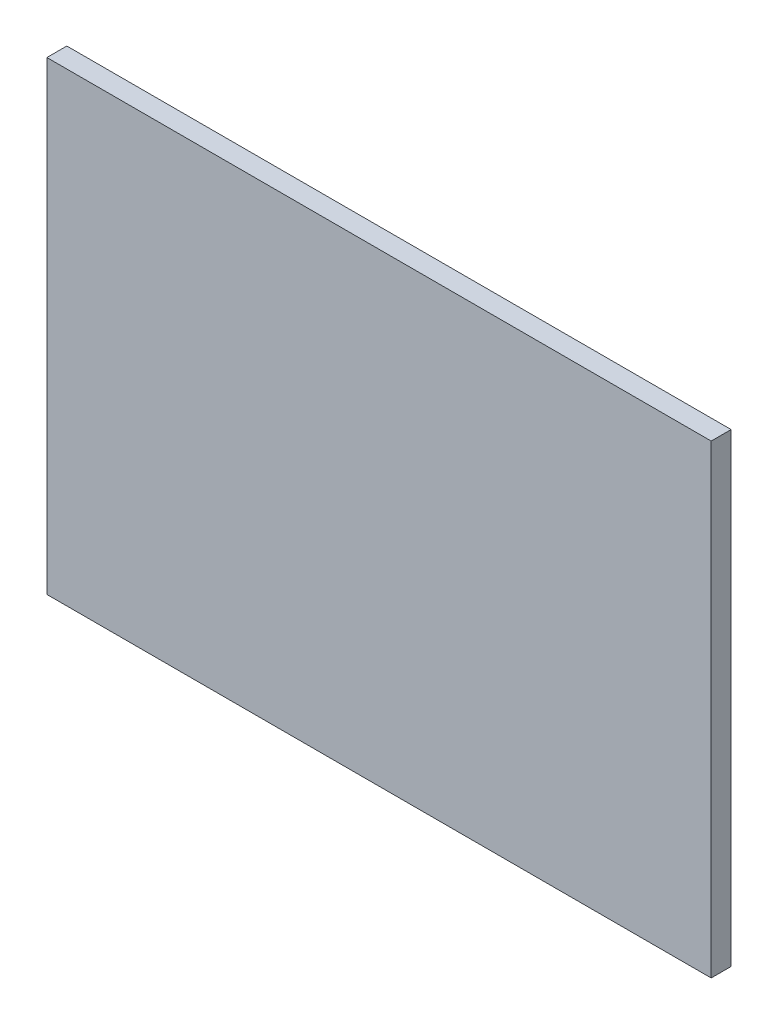
from build123d import *

# Parameters (mm, degrees)
SKETCH2_W           = 100
SKETCH2_H           = 70
BOSS_EXTRUDE1_DEPTH = 3


with BuildPart() as part:
    # Sketch2 → Boss-Extrude1 (new body)
    with BuildSketch(Plane.XY):
        Rectangle(SKETCH2_W, SKETCH2_H)
    extrude(amount=BOSS_EXTRUDE1_DEPTH)


solid = part.part
